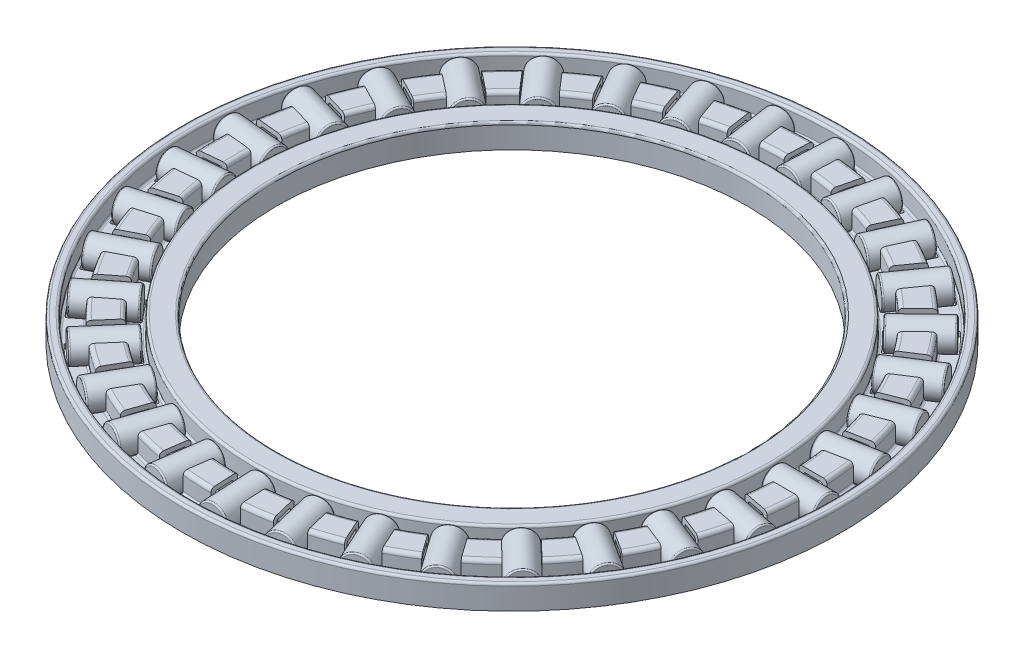
from build123d import *

# Parameters (mm, degrees)
FILLET1_R                = 0.4
FILLET2_R                = 0.4
FILLET3_R                = 0.25
FILLET4_R                = 0.2
CUT_EXTRUDE1_DEPTH       = 50.513893252
FILLET5_R                = 0.150049647
CIRPATTERN1_COUNT        = 33
FILLET5_OF_CIRPATTERN1_R = 0.150049647
SKETCH5_W                = 5.555300686
SKETCH5_H                = 1.5
FILLET6_R                = 0.150049647
CIRPATTERN2_COUNT        = 33


with BuildPart() as part:
    # Sketch3 → Revolve1 (revolve)
    with BuildSketch(Plane(origin=(0, 0, 0), x_dir=(0, 0, -1), z_dir=(1, 0, 0))):
        Polygon((25.85, -1.275), (25.85, 0.779166667), (26.675, 0.779166667), (26.675, -1.275), (29.504166667, -1.275), (29.504166667, 0.779166667), (31.504166667, 0.779166667), (31.504166667, -1.275), (34.333333333, -1.275), (34.333333333, 0.779166667), (34.666666667, 0.779166667), (34.666666667, -1.275), (35, -1.275), (35, 1.275), (34, 1.275), (34, -0.779166667), (32, -0.779166667), (32, 1.275), (29.008333333, 1.275), (29.008333333, -0.779166667), (27.5, -0.779166667), (27.5, 1.275), (25.025, 1.275), (25.025, -1.275), align=None)
    revolve(axis=Axis((0, 1.5, 0), (0, -1, 0)))

    # Fillet1
    fillet1_edges = [part.edges().sort_by_distance(p)[0] for p in [
        (0, -1.275, 31.504166667),
        (0, -1.275, 34.333333333),
        (0, -1.275, 26.675),
        (0, -1.275, 29.504166667),
    ]]
    fillet(fillet1_edges, radius=FILLET1_R)

    # Fillet2
    fillet2_edges = [part.edges().sort_by_distance(p)[0] for p in [
        (0, 1.275, 32),
        (0, 1.275, 29.008333333),
    ]]
    fillet(fillet2_edges, radius=FILLET2_R)

    # Fillet3
    fillet3_edges = [part.edges().sort_by_distance(p)[0] for p in [
        (0, 1.275, 34),
        (0, 1.275, 35),
        (0, 1.275, 27.5),
        (0, 1.275, 25.025),
    ]]
    fillet(fillet3_edges, radius=FILLET3_R)

    # Fillet4
    fillet4_edges = [part.edges().sort_by_distance(p)[0] for p in [
        (0, 0.779166667, 29.504166667),
        (0, 0.779166667, 31.504166667),
        (0, -0.779166667, 34),
        (0, -0.779166667, 32),
        (0, -0.779166667, 29.008333333),
        (0, -0.779166667, 27.5),
    ]]
    fillet(fillet4_edges, radius=FILLET4_R)

    # Sketch4 → Cut-Extrude1 (cut, symmetric)
    with BuildSketch(Plane(origin=(0, 0, 0), x_dir=(1, 0, 0), z_dir=(0, 1, 0))):
        with BuildLine():
            Line((27.784539316, 1.5), (33.64157584, 1.5))
            ThreePointArc((33.64157584, 1.5), (33.675, 0), (33.64157584, -1.5))
            Line((33.64157584, -1.5), (27.784539316, -1.5))
            ThreePointArc((27.784539316, -1.5), (27.825, 0), (27.784539316, 1.5))
        make_face()
    cut_extrude1 = extrude(amount=CUT_EXTRUDE1_DEPTH, both=True, mode=Mode.SUBTRACT)

    # Fillet5
    fillet5_edges = [part.edges().sort_by_distance(p)[0] for p in [
        (33.64157584, -1.027083333, -1.5),
        (33.64157584, -1.027083333, 1.5),
        (27.784539316, -1.027083333, -1.5),
        (27.784539316, -1.027083333, 1.5),
    ]]
    fillet(fillet5_edges, radius=FILLET5_R)

    # CirPattern1: Cut-Extrude1 ×33 about axis
    cirpattern1_axis = Axis((0, 1.5, 0), (0, -1, 0))
    for i in range(1, CIRPATTERN1_COUNT):
        add(cut_extrude1.rotate(cirpattern1_axis, i * 360 / CIRPATTERN1_COUNT), mode=Mode.SUBTRACT)

    # Fillet5 of CirPattern1
    fillet5_of_cirpattern1_edges = [part.edges().sort_by_distance(p)[0] for p in [
        (33.317505605, -1.027083333, 4.893817044),
        (32.749751872, -1.027083333, 7.839603136),
        (27.566313361, -1.027083333, 3.785365594),
        (26.998559628, -1.027083333, 6.731151685),
        (31.789253909, -1.027083333, 11.110758789),
        (30.674266543, -1.027083333, 13.895862589),
        (26.351769018, -1.027083333, 8.933918212),
        (25.236781651, -1.027083333, 11.719022011),
        (29.112055752, -1.027083333, 16.926128763),
        (27.490133299, -1.027083333, 19.449889362),
        (24.184803084, -1.027083333, 13.759575749),
        (22.562880631, -1.027083333, 16.283336348),
        (25.382672048, -1.027083333, 22.129744343),
        (23.312435014, -1.027083333, 24.300946458),
        (21.143735353, -1.027083333, 18.087926368),
        (19.073498319, -1.027083333, 20.259128483),
        (20.735892443, -1.027083333, 26.533533304),
        (18.292164587, -1.027083333, 28.273704033),
        (17.338477938, -1.027083333, 21.762532201),
        (14.894750081, -1.027083333, 23.50270293),
        (15.339663658, -1.027083333, 29.978331239),
        (12.610767672, -1.027083333, 31.224576278),
        (12.906562754, -1.027083333, 24.650583418),
        (10.177666768, -1.027083333, 25.896828457),
        (9.389019461, -1.027083333, 32.339634175),
        (6.473584756, -1.027083333, 33.046910981),
        (8.008170765, -1.027083333, 26.647698325),
        (5.09273606, -1.027083333, 27.354975131),
        (3.099031639, -1.027083333, 33.532098472),
        (0.102429621, -1.027083333, 33.674844219),
        (2.82034262, -1.027083333, 27.681695983),
        (-0.176259398, -1.027083333, 27.824441731),
        (-3.302963262, -1.027083333, 33.512625363),
        (-6.272427588, -1.027083333, 33.085680848),
        (-2.469420056, -1.027083333, 27.715205025),
        (-5.438884382, -1.027083333, 27.28826051),
        (-9.585580465, -1.027083333, 32.281918657),
        (-12.420582921, -1.027083333, 31.300714767),
        (-7.669931458, -1.027083333, 26.747014346),
        (-10.504933914, -1.027083333, 25.765810456),
        (-15.521749814, -1.027083333, 29.884459301),
        (-18.119826026, -1.027083333, 28.384459301),
        (-12.593231552, -1.027083333, 24.81211688),
        (-15.191307764, -1.027083333, 23.31211688),
        (-20.896922684, -1.027083333, 26.406897723),
        (-23.164171407, -1.027083333, 24.442315521),
        (-17.061379447, -1.027083333, 21.980444863),
        (-19.32862817, -1.027083333, 20.015862661),
        (-25.516826322, -1.027083333, 21.974922058),
        (-27.37130328, -1.027083333, 19.616762774),
        (-20.912884636, -1.027083333, 18.354342298),
        (-22.767361595, -1.027083333, 15.996183014),
        (-29.214485373, -1.027083333, 16.748715456),
        (-30.589164938, -1.027083333, 14.08220911),
        (-24.008543686, -1.027083333, 14.064865982),
        (-25.383223251, -1.027083333, 11.398359636),
        (-31.856256805, -1.027083333, 10.917166638),
        (-32.701454475, -1.027083333, 8.038687717),
        (-26.236471414, -1.027083333, 9.267048763),
        (-27.081669084, -1.027083333, 6.388569842),
        (-33.346660115, -1.027083333, 4.691042974),
        (-33.631828245, -1.027083333, 1.704627206),
        (-27.516144706, -1.027083333, 4.134296256),
        (-27.801312836, -1.027083333, 1.147880489),
        (-33.631828245, -1.027083333, -1.704627206),
        (-33.346660115, -1.027083333, -4.691042974),
        (-27.801312836, -1.027083333, -1.147880489),
        (-27.516144706, -1.027083333, -4.134296256),
        (-32.701454475, -1.027083333, -8.038687717),
        (-31.856256805, -1.027083333, -10.917166638),
        (-27.081669084, -1.027083333, -6.388569842),
        (-26.236471414, -1.027083333, -9.267048763),
        (-30.589164938, -1.027083333, -14.08220911),
        (-29.214485373, -1.027083333, -16.748715456),
        (-25.383223251, -1.027083333, -11.398359636),
        (-24.008543686, -1.027083333, -14.064865982),
        (-27.37130328, -1.027083333, -19.616762774),
        (-25.516826322, -1.027083333, -21.974922058),
        (-22.767361595, -1.027083333, -15.996183014),
        (-20.912884636, -1.027083333, -18.354342298),
        (-23.164171407, -1.027083333, -24.442315521),
        (-20.896922684, -1.027083333, -26.406897723),
        (-19.32862817, -1.027083333, -20.015862661),
        (-17.061379447, -1.027083333, -21.980444863),
        (-18.119826026, -1.027083333, -28.384459301),
        (-15.521749814, -1.027083333, -29.884459301),
        (-15.191307764, -1.027083333, -23.31211688),
        (-12.593231552, -1.027083333, -24.81211688),
        (-12.420582921, -1.027083333, -31.300714767),
        (-9.585580465, -1.027083333, -32.281918657),
        (-10.504933914, -1.027083333, -25.765810456),
        (-7.669931458, -1.027083333, -26.747014346),
        (-6.272427588, -1.027083333, -33.085680848),
        (-3.302963262, -1.027083333, -33.512625363),
        (-5.438884382, -1.027083333, -27.28826051),
        (-2.469420056, -1.027083333, -27.715205025),
        (0.102429621, -1.027083333, -33.674844219),
        (3.099031639, -1.027083333, -33.532098472),
        (-0.176259398, -1.027083333, -27.824441731),
        (2.82034262, -1.027083333, -27.681695983),
        (6.473584756, -1.027083333, -33.046910981),
        (9.389019461, -1.027083333, -32.339634175),
        (5.09273606, -1.027083333, -27.354975131),
        (8.008170765, -1.027083333, -26.647698325),
        (12.610767672, -1.027083333, -31.224576278),
        (15.339663658, -1.027083333, -29.978331239),
        (10.177666768, -1.027083333, -25.896828457),
        (12.906562754, -1.027083333, -24.650583418),
        (18.292164587, -1.027083333, -28.273704033),
        (20.735892443, -1.027083333, -26.533533304),
        (14.894750081, -1.027083333, -23.50270293),
        (17.338477938, -1.027083333, -21.762532201),
        (23.312435014, -1.027083333, -24.300946458),
        (25.382672048, -1.027083333, -22.129744343),
        (19.073498319, -1.027083333, -20.259128483),
        (21.143735353, -1.027083333, -18.087926368),
        (27.490133299, -1.027083333, -19.449889362),
        (29.112055752, -1.027083333, -16.926128763),
        (22.562880631, -1.027083333, -16.283336348),
        (24.184803084, -1.027083333, -13.759575749),
        (30.674266543, -1.027083333, -13.895862589),
        (31.789253909, -1.027083333, -11.110758789),
        (25.236781651, -1.027083333, -11.719022011),
        (26.351769018, -1.027083333, -8.933918212),
        (32.749751872, -1.027083333, -7.839603136),
        (33.317505605, -1.027083333, -4.893817044),
        (26.998559628, -1.027083333, -6.731151685),
        (27.566313361, -1.027083333, -3.785365594),
    ]]
    fillet(fillet5_of_cirpattern1_edges, radius=FILLET5_OF_CIRPATTERN1_R)


with BuildPart() as body_2:
    # Sketch5 → Revolve2 (revolve)
    with BuildSketch(Plane(origin=(0, 0, 0), x_dir=(1, 0, 0), z_dir=(0, 1, 0))):
        with Locations((30.720109734, 0.75)):
            Rectangle(SKETCH5_W, SKETCH5_H)
    revolve(axis=Axis((33.675, 0, 0), (-1, 0, 0)))

    # Fillet6
    fillet6_edges = [body_2.edges().sort_by_distance(p)[0] for p in [
        (27.942459391, 0, 1.5),
        (33.497760077, 0, 1.5),
    ]]
    fillet(fillet6_edges, radius=FILLET6_R)


with BuildPart() as cirpattern2_1:
    # CirPattern2: pattern copy
    add(body_2.part.rotate(Axis((0, 1.5, 0), (0, -1, 0)), 1 * 360 / CIRPATTERN2_COUNT))


with BuildPart() as cirpattern2_2:
    # CirPattern2: pattern copy
    add(body_2.part.rotate(Axis((0, 1.5, 0), (0, -1, 0)), 2 * 360 / CIRPATTERN2_COUNT))


with BuildPart() as cirpattern2_3:
    # CirPattern2: pattern copy
    add(body_2.part.rotate(Axis((0, 1.5, 0), (0, -1, 0)), 3 * 360 / CIRPATTERN2_COUNT))


with BuildPart() as cirpattern2_4:
    # CirPattern2: pattern copy
    add(body_2.part.rotate(Axis((0, 1.5, 0), (0, -1, 0)), 4 * 360 / CIRPATTERN2_COUNT))


with BuildPart() as cirpattern2_5:
    # CirPattern2: pattern copy
    add(body_2.part.rotate(Axis((0, 1.5, 0), (0, -1, 0)), 5 * 360 / CIRPATTERN2_COUNT))


with BuildPart() as cirpattern2_6:
    # CirPattern2: pattern copy
    add(body_2.part.rotate(Axis((0, 1.5, 0), (0, -1, 0)), 6 * 360 / CIRPATTERN2_COUNT))


with BuildPart() as cirpattern2_7:
    # CirPattern2: pattern copy
    add(body_2.part.rotate(Axis((0, 1.5, 0), (0, -1, 0)), 7 * 360 / CIRPATTERN2_COUNT))


with BuildPart() as cirpattern2_8:
    # CirPattern2: pattern copy
    add(body_2.part.rotate(Axis((0, 1.5, 0), (0, -1, 0)), 8 * 360 / CIRPATTERN2_COUNT))


with BuildPart() as cirpattern2_9:
    # CirPattern2: pattern copy
    add(body_2.part.rotate(Axis((0, 1.5, 0), (0, -1, 0)), 9 * 360 / CIRPATTERN2_COUNT))


with BuildPart() as cirpattern2_10:
    # CirPattern2: pattern copy
    add(body_2.part.rotate(Axis((0, 1.5, 0), (0, -1, 0)), 10 * 360 / CIRPATTERN2_COUNT))


with BuildPart() as cirpattern2_11:
    # CirPattern2: pattern copy
    add(body_2.part.rotate(Axis((0, 1.5, 0), (0, -1, 0)), 11 * 360 / CIRPATTERN2_COUNT))


with BuildPart() as cirpattern2_12:
    # CirPattern2: pattern copy
    add(body_2.part.rotate(Axis((0, 1.5, 0), (0, -1, 0)), 12 * 360 / CIRPATTERN2_COUNT))


with BuildPart() as cirpattern2_13:
    # CirPattern2: pattern copy
    add(body_2.part.rotate(Axis((0, 1.5, 0), (0, -1, 0)), 13 * 360 / CIRPATTERN2_COUNT))


with BuildPart() as cirpattern2_14:
    # CirPattern2: pattern copy
    add(body_2.part.rotate(Axis((0, 1.5, 0), (0, -1, 0)), 14 * 360 / CIRPATTERN2_COUNT))


with BuildPart() as cirpattern2_15:
    # CirPattern2: pattern copy
    add(body_2.part.rotate(Axis((0, 1.5, 0), (0, -1, 0)), 15 * 360 / CIRPATTERN2_COUNT))


with BuildPart() as cirpattern2_16:
    # CirPattern2: pattern copy
    add(body_2.part.rotate(Axis((0, 1.5, 0), (0, -1, 0)), 16 * 360 / CIRPATTERN2_COUNT))


with BuildPart() as cirpattern2_17:
    # CirPattern2: pattern copy
    add(body_2.part.rotate(Axis((0, 1.5, 0), (0, -1, 0)), 17 * 360 / CIRPATTERN2_COUNT))


with BuildPart() as cirpattern2_18:
    # CirPattern2: pattern copy
    add(body_2.part.rotate(Axis((0, 1.5, 0), (0, -1, 0)), 18 * 360 / CIRPATTERN2_COUNT))


with BuildPart() as cirpattern2_19:
    # CirPattern2: pattern copy
    add(body_2.part.rotate(Axis((0, 1.5, 0), (0, -1, 0)), 19 * 360 / CIRPATTERN2_COUNT))


with BuildPart() as cirpattern2_20:
    # CirPattern2: pattern copy
    add(body_2.part.rotate(Axis((0, 1.5, 0), (0, -1, 0)), 20 * 360 / CIRPATTERN2_COUNT))


with BuildPart() as cirpattern2_21:
    # CirPattern2: pattern copy
    add(body_2.part.rotate(Axis((0, 1.5, 0), (0, -1, 0)), 21 * 360 / CIRPATTERN2_COUNT))


with BuildPart() as cirpattern2_22:
    # CirPattern2: pattern copy
    add(body_2.part.rotate(Axis((0, 1.5, 0), (0, -1, 0)), 22 * 360 / CIRPATTERN2_COUNT))


with BuildPart() as cirpattern2_23:
    # CirPattern2: pattern copy
    add(body_2.part.rotate(Axis((0, 1.5, 0), (0, -1, 0)), 23 * 360 / CIRPATTERN2_COUNT))


with BuildPart() as cirpattern2_24:
    # CirPattern2: pattern copy
    add(body_2.part.rotate(Axis((0, 1.5, 0), (0, -1, 0)), 24 * 360 / CIRPATTERN2_COUNT))


with BuildPart() as cirpattern2_25:
    # CirPattern2: pattern copy
    add(body_2.part.rotate(Axis((0, 1.5, 0), (0, -1, 0)), 25 * 360 / CIRPATTERN2_COUNT))


with BuildPart() as cirpattern2_26:
    # CirPattern2: pattern copy
    add(body_2.part.rotate(Axis((0, 1.5, 0), (0, -1, 0)), 26 * 360 / CIRPATTERN2_COUNT))


with BuildPart() as cirpattern2_27:
    # CirPattern2: pattern copy
    add(body_2.part.rotate(Axis((0, 1.5, 0), (0, -1, 0)), 27 * 360 / CIRPATTERN2_COUNT))


with BuildPart() as cirpattern2_28:
    # CirPattern2: pattern copy
    add(body_2.part.rotate(Axis((0, 1.5, 0), (0, -1, 0)), 28 * 360 / CIRPATTERN2_COUNT))


with BuildPart() as cirpattern2_29:
    # CirPattern2: pattern copy
    add(body_2.part.rotate(Axis((0, 1.5, 0), (0, -1, 0)), 29 * 360 / CIRPATTERN2_COUNT))


with BuildPart() as cirpattern2_30:
    # CirPattern2: pattern copy
    add(body_2.part.rotate(Axis((0, 1.5, 0), (0, -1, 0)), 30 * 360 / CIRPATTERN2_COUNT))


with BuildPart() as cirpattern2_31:
    # CirPattern2: pattern copy
    add(body_2.part.rotate(Axis((0, 1.5, 0), (0, -1, 0)), 31 * 360 / CIRPATTERN2_COUNT))


with BuildPart() as cirpattern2_32:
    # CirPattern2: pattern copy
    add(body_2.part.rotate(Axis((0, 1.5, 0), (0, -1, 0)), 32 * 360 / CIRPATTERN2_COUNT))


solid = Compound([part.part, body_2.part, cirpattern2_1.part, cirpattern2_2.part, cirpattern2_3.part, cirpattern2_4.part, cirpattern2_5.part, cirpattern2_6.part, cirpattern2_7.part, cirpattern2_8.part, cirpattern2_9.part, cirpattern2_10.part, cirpattern2_11.part, cirpattern2_12.part, cirpattern2_13.part, cirpattern2_14.part, cirpattern2_15.part, cirpattern2_16.part, cirpattern2_17.part, cirpattern2_18.part, cirpattern2_19.part, cirpattern2_20.part, cirpattern2_21.part, cirpattern2_22.part, cirpattern2_23.part, cirpattern2_24.part, cirpattern2_25.part, cirpattern2_26.part, cirpattern2_27.part, cirpattern2_28.part, cirpattern2_29.part, cirpattern2_30.part, cirpattern2_31.part, cirpattern2_32.part])
